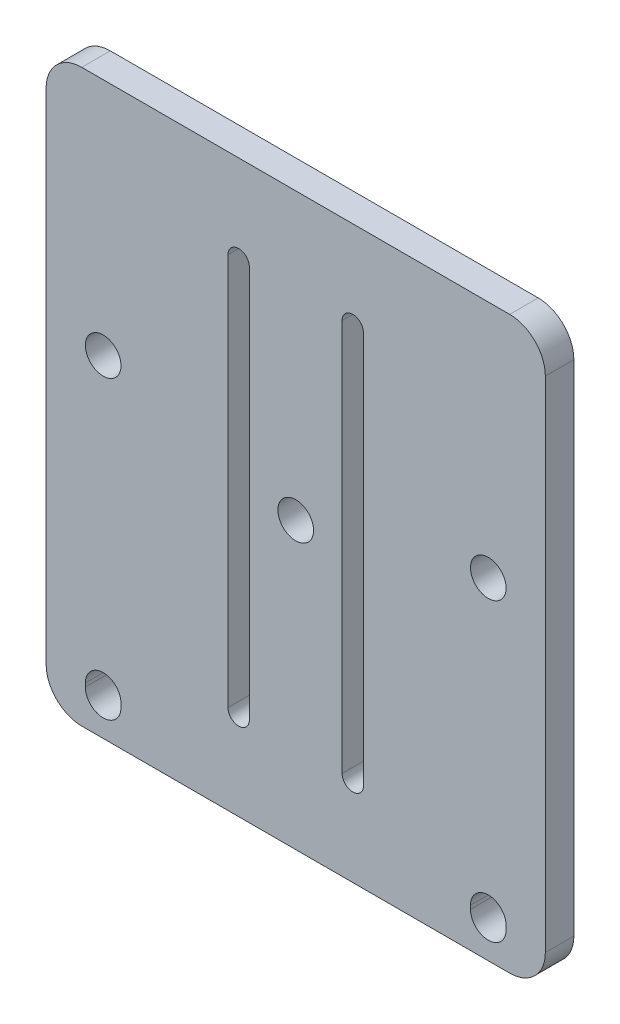
from build123d import *

# Parameters (mm, degrees)
SKETCH4_W           = 70
SKETCH4_H           = 80
SKETCH4_R           = 2.5
BOSS_EXTRUDE2_DEPTH = 4
FILLET1_R           = 5
SKETCH6_R           = 2.5
CUT_EXTRUDE1_DEPTH  = 54.301031885


with BuildPart() as part:
    # Sketch4 → Boss-Extrude2 (new body)
    with BuildSketch(Plane.XY):
        Rectangle(SKETCH4_W, SKETCH4_H)
        with Locations((-27, 6.5)):
            Circle(SKETCH4_R, mode=Mode.SUBTRACT)
        with Locations((27, 6.5)):
            Circle(SKETCH4_R, mode=Mode.SUBTRACT)
        with BuildLine():
            Line((-24.5, -34.5), (-24.5, -35))
            ThreePointArc((-24.5, -35), (-27, -37.5), (-29.5, -35))
            Line((-29.5, -35), (-29.5, -34.5))
            ThreePointArc((-29.5, -34.5), (-27, -32), (-24.5, -34.5))
        make_face(mode=Mode.SUBTRACT)
        with BuildLine():
            Line((24.5, -34.5), (24.5, -35))
            ThreePointArc((24.5, -35), (27, -37.5), (29.5, -35))
            Line((29.5, -35), (29.5, -34.5))
            ThreePointArc((29.5, -34.5), (27, -32), (24.5, -34.5))
        make_face(mode=Mode.SUBTRACT)
    extrude(amount=BOSS_EXTRUDE2_DEPTH)

    # Fillet1
    fillet1_edges = [part.edges().sort_by_distance(p)[0] for p in [
        (-35, -40, 2),
        (35, -40, 2),
        (35, 40, 2),
        (-35, 40, 2),
    ]]
    fillet(fillet1_edges, radius=FILLET1_R)

    # Sketch6 → Cut-Extrude1 (cut, through all)
    with BuildSketch(Plane.XY.offset(4)):
        Circle(SKETCH6_R)
        with BuildLine():
            Line((-6.5, 27.5), (-6.5, -27.5))
            ThreePointArc((-6.5, -27.5), (-8, -29), (-9.5, -27.5))
            Line((-9.5, -27.5), (-9.5, 27.5))
            ThreePointArc((-9.5, 27.5), (-8, 29), (-6.5, 27.5))
        make_face()
        with BuildLine():
            Line((6.5, 27.5), (6.5, -27.5))
            ThreePointArc((6.5, -27.5), (8, -29), (9.5, -27.5))
            Line((9.5, -27.5), (9.5, 27.5))
            ThreePointArc((9.5, 27.5), (8, 29), (6.5, 27.5))
        make_face()
    extrude(amount=-CUT_EXTRUDE1_DEPTH, mode=Mode.SUBTRACT)


solid = part.part
